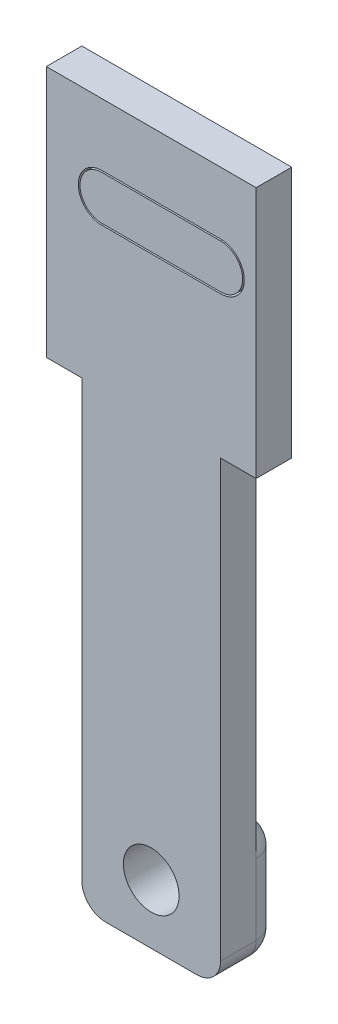
from build123d import *

# Parameters (mm, degrees)
SKETCH1_W               = 17.7
SKETCH1_H               = 60
BOSS_EXTRUDE1_DEPTH     = 3
SKETCH2_W               = 3
SKETCH2_H               = 38.75
CUT_EXTRUDE1_DEPTH      = 56.240991234
CUT_EXTRUDE2_DEPTH      = 56.240991234
CUT_EXTRUDE3_DEPTH      = 2
SKETCH5_W               = 11.7
SKETCH5_H               = 10
BOSS_EXTRUDE2_DEPTH     = 2
CUT_EXTRUDE4_DEPTH      = 56.385621893
CUT_EXTRUDE4_DEPTH_BACK = 56.385621893
SKETCH6_R               = 2.35
FILLET1_R               = 2
FILLET2_R               = 2
FILLET3_R               = 2
FILLET4_R               = 2
BOSS_EXTRUDE3_DEPTH     = 1.75


with BuildPart() as part:
    # Sketch1 → Boss-Extrude1 (new body)
    with BuildSketch(Plane.XY):
        with Locations((-34.564285714, 4.025974026)):
            Rectangle(SKETCH1_W, SKETCH1_H)
    extrude(amount=BOSS_EXTRUDE1_DEPTH)

    # Sketch2 → Cut-Extrude1 (cut, through all)
    with BuildSketch(Plane.XY.offset(3)):
        with Locations((-41.914285714, -6.599025974)):
            Rectangle(SKETCH2_W, SKETCH2_H)
        with Locations((-27.214285714, -6.599025974)):
            Rectangle(SKETCH2_W, SKETCH2_H)
    extrude(amount=-CUT_EXTRUDE1_DEPTH, mode=Mode.SUBTRACT)

    # Sketch3 → Cut-Extrude2 (cut, through all)
    with BuildSketch(Plane.XY.offset(3)):
        with BuildLine():
            Line((-28.714285714, 25.525974026), (-38.714285714, 25.525974026))
            ThreePointArc((-38.714285714, 25.525974026), (-39.964285714, 26.775974026), (-38.714285714, 28.025974026))
            Line((-38.714285714, 28.025974026), (-28.714285714, 28.025974026))
            ThreePointArc((-28.714285714, 28.025974026), (-27.464285714, 26.775974026), (-28.714285714, 25.525974026))
        make_face()
    extrude(amount=-CUT_EXTRUDE2_DEPTH, mode=Mode.SUBTRACT)

    # Sketch4 → Cut-Extrude3 (cut)
    with BuildSketch(Plane.XY.offset(3)):
        with BuildLine():
            Line((-38.714285714, 28.775974026), (-28.714285714, 28.775974026))
            ThreePointArc((-28.714285714, 28.775974026), (-26.714285714, 26.775974026), (-28.714285714, 24.775974026))
            Line((-28.714285714, 24.775974026), (-38.714285714, 24.775974026))
            ThreePointArc((-38.714285714, 24.775974026), (-40.714285714, 26.775974026), (-38.714285714, 28.775974026))
        make_face()
    extrude(amount=-CUT_EXTRUDE3_DEPTH, mode=Mode.SUBTRACT)

    # Sketch5 → Boss-Extrude2 (add)
    with BuildSketch(Plane(origin=(0, 0, 0), x_dir=(-1, 0, 0), z_dir=(0, 0, -1))):
        with Locations((34.564285714, -20.974025974)):
            Rectangle(SKETCH5_W, SKETCH5_H)
    extrude(amount=BOSS_EXTRUDE2_DEPTH)

    # Sketch6 → Cut-Extrude4 (cut, two sides: drawn at the far end of the back side and taken through both)
    with BuildSketch(Plane(origin=(0, 0, -2), x_dir=(-1, 0, 0), z_dir=(0, 0, -1)).offset(-CUT_EXTRUDE4_DEPTH_BACK)):
        with Locations((34.564285714, -20.974025974)):
            Circle(SKETCH6_R)
    extrude(amount=CUT_EXTRUDE4_DEPTH + CUT_EXTRUDE4_DEPTH_BACK, mode=Mode.SUBTRACT)

    # Fillet1
    fillet1_edges = [part.edges().sort_by_distance(p)[0] for p in [
        (-34.564285714, -25.974025974, -2),
    ]]
    fillet(fillet1_edges, radius=FILLET1_R)

    # Fillet2
    fillet2_edges = [part.edges().sort_by_distance(p)[0] for p in [
        (-34.564285714, -15.974025974, -2),
    ]]
    fillet(fillet2_edges, radius=FILLET2_R - 0.0001)  # a hair under: the kernel refuses the full size

    # Fillet3
    fillet3_edges = [part.edges().sort_by_distance(p)[0] for p in [
        (-28.714285714, -25.974025974, 1.5),
        (-28.714285714, -25.388239536, -1.414213562),
        (-28.714285714, -20.973975974, -2),
        (-28.714285714, -16.559783122, -1.414242852),
    ]]
    fillet(fillet3_edges, radius=FILLET3_R - 0.0001)  # a hair under: the kernel refuses the full size

    # Fillet4
    fillet4_edges = [part.edges().sort_by_distance(p)[0] for p in [
        (-40.414285714, -20.973975974, -2),
        (-40.414285714, -25.974025974, 1.5),
        (-40.414285714, -25.388239536, -1.414213562),
        (-40.414285714, -16.559783122, -1.414242852),
    ]]
    fillet(fillet4_edges, radius=FILLET4_R - 0.0001)  # a hair under: the kernel refuses the full size


with BuildPart() as body_2:
    # Sketch7 → Boss-Extrude3 (new body)
    with BuildSketch(Plane.XY.offset(3)):
        with BuildLine():
            Line((-28.714285714, 24.914251461), (-38.714285714, 24.914251461))
            ThreePointArc((-38.714285714, 24.914251461), (-40.576008279, 26.775974026), (-38.714285714, 28.637696591))
            Line((-38.714285714, 28.637696591), (-28.714285714, 28.637696591))
            ThreePointArc((-28.714285714, 28.637696591), (-26.85256315, 26.775974026), (-28.714285714, 24.914251461))
        make_face()
    extrude(amount=-BOSS_EXTRUDE3_DEPTH)


solid = Compound([part.part, body_2.part])
